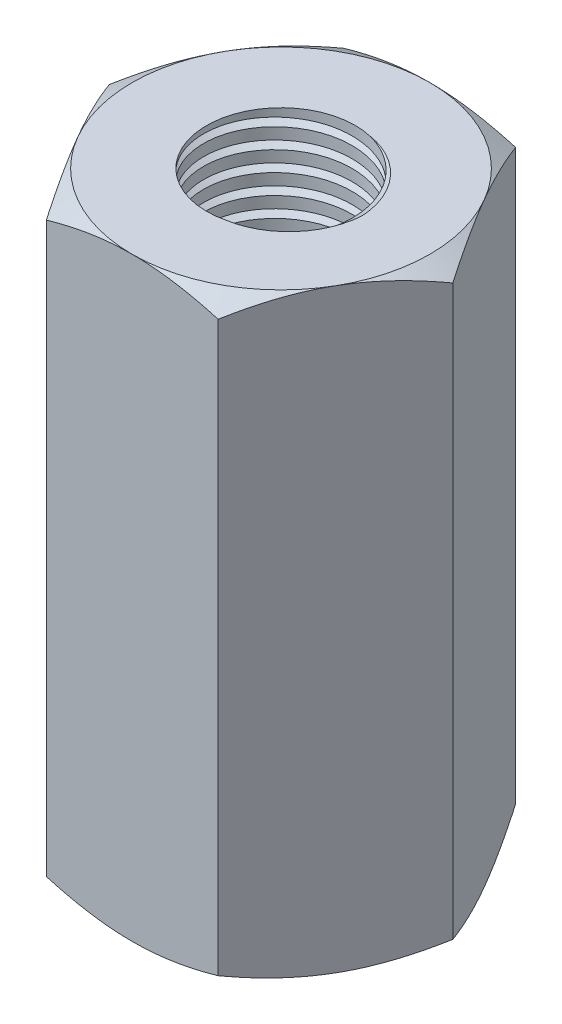
from build123d import *

# Parameters (mm, degrees)
SKETCH1_R           = 1.5
BOSS_EXTRUDE1_DEPTH = 12
SKETCH2_OUTSIDE_W   = 15.412
SKETCH2_OUTSIDE_H   = 14.484
SKETCH2_OUTSIDE_R   = 3
CUT_EXTRUDE2_DEPTH  = 1
CUT_EXTRUDE2_DRAFT  = -60
SKETCH4_OUTSIDE_W   = 15.412
SKETCH4_OUTSIDE_H   = 14.484
SKETCH4_OUTSIDE_R   = 3
CUT_EXTRUDE3_DEPTH  = 1
CUT_EXTRUDE3_DRAFT  = -60
CUT_SWEEP1_PITCH    = 0.4


with BuildPart() as part:
    # Sketch1 → Boss-Extrude1 (new body)
    with BuildSketch(Plane(origin=(0, 0, 0), x_dir=(1, 0, 0), z_dir=(0, 1, 0))):
        Polygon((3.464101615, 0), (1.732050808, 3), (-1.732050808, 3), (-3.464101615, 0), (-1.732050808, -3), (1.732050808, -3), align=None)
        with Locations(Location((0, 0, 0), (0, 0, 270))):
            Circle(SKETCH1_R, mode=Mode.SUBTRACT)
    extrude(amount=BOSS_EXTRUDE1_DEPTH)


with BuildPart() as cut_extrude2_tool:
    # Sketch2 outside → Cut-Extrude2 (with draft: the straight prism first)
    with BuildSketch(Plane(origin=(0, 12, 0), x_dir=(1, 0, 0), z_dir=(0, 1, 0))):
        Rectangle(SKETCH2_OUTSIDE_W, SKETCH2_OUTSIDE_H)
        Circle(SKETCH2_OUTSIDE_R, mode=Mode.SUBTRACT)
    extrude(amount=-CUT_EXTRUDE2_DEPTH)
    # Cut-Extrude2: the draft: its side faces are tilted about the plane it starts from
    cut_extrude2_sides = [cut_extrude2_tool.faces().sort_by_distance(p)[0] for p in [
        (0, 11.5, 7.242),
        (7.706, 11.5, 0),
        (0, 11.5, -7.242),
        (-7.706, 11.5, 0),
        (-3, 11.5, 0),
    ]]
    draft(cut_extrude2_sides, Plane(origin=(0, 12, 0), x_dir=(1, 0, 0), z_dir=(0, 1, 0)), CUT_EXTRUDE2_DRAFT)


with BuildPart() as part_1:
    add(part.part)

    # Cut-Extrude2: cut by cut_extrude2_tool
    add(cut_extrude2_tool.part, mode=Mode.SUBTRACT)


with BuildPart() as cut_extrude3_tool:
    # Sketch4 outside → Cut-Extrude3 (with draft: the straight prism first)
    with BuildSketch(Plane.XZ):
        Rectangle(SKETCH4_OUTSIDE_W, SKETCH4_OUTSIDE_H)
        Circle(SKETCH4_OUTSIDE_R, mode=Mode.SUBTRACT)
    extrude(amount=-CUT_EXTRUDE3_DEPTH)
    # Cut-Extrude3: the draft: its side faces are tilted about the plane it starts from
    cut_extrude3_sides = [cut_extrude3_tool.faces().sort_by_distance(p)[0] for p in [
        (0, 0.5, -7.242),
        (7.706, 0.5, 0),
        (0, 0.5, 7.242),
        (-7.706, 0.5, 0),
        (-3, 0.5, 0),
    ]]
    draft(cut_extrude3_sides, Plane.XZ, CUT_EXTRUDE3_DRAFT)


with BuildPart() as part_2:
    add(part_1.part)

    # Cut-Extrude3: cut by cut_extrude3_tool
    add(cut_extrude3_tool.part, mode=Mode.SUBTRACT)

    # Cut-Sweep1: arcs per turn and ends read off the stored shape
    # Cut-Sweep1: the profile of 3DSketch2 screwed along a right-hand helix through 34.75 turns, 6 arcs to a turn; built about Z, then put on its axis
    cut_sweep1_z = Axis((0, 0, 0), (0, 0, 1))
    cut_sweep1_corners = [(1.353889507, 0, -0.568713864), (1.353889507, 0, -0.231286136), (1.646110493, 0, -0.4)]
    with BuildLine(mode=Mode.PRIVATE) as cut_sweep1_profile:
        Line(cut_sweep1_corners[0], cut_sweep1_corners[1])
        Line(cut_sweep1_corners[1], cut_sweep1_corners[2])
        Line(cut_sweep1_corners[2], cut_sweep1_corners[0])
    cut_sweep1_cap = Face(cut_sweep1_profile.wire())
    cut_sweep1_turn_angles = [0, 30, 60, 90, 120, 150, 180, 210, 240, 270, 300, 330, 360]
    cut_sweep1_turn_weights = [1, 0.8660254037844387, 1, 0.8660254037844387, 1, 0.8660254037844387, 1, 0.8660254037844387, 1, 0.8660254037844387, 1, 0.8660254037844387, 1]
    cut_sweep1_turn_rails = [Edge.make_bspline([Vector(p[0], p[1], 0).rotate(cut_sweep1_z, cut_sweep1_turn_angles[k]) / cut_sweep1_turn_weights[k] + Vector(0, 0, p[2] + CUT_SWEEP1_PITCH * cut_sweep1_turn_angles[k] / 360) for k in range(13)], [0, 0, 0, 1, 1, 2, 2, 3, 3, 4, 4, 5, 5, 6, 6, 6], 2, cut_sweep1_turn_weights) for p in cut_sweep1_corners]
    cut_sweep1_turn_sides = [Face.make_surface_from_curves(cut_sweep1_turn_rails[p[0]], cut_sweep1_turn_rails[p[1]]) for p in [(0, 1), (1, 2), (2, 0)]]
    cut_sweep1_last_angles = [12240, 12270, 12300, 12330, 12360, 12390, 12420, 12450, 12480, 12495, 12510]
    cut_sweep1_last_weights = [1, 0.8660254037844387, 1, 0.8660254037844387, 1, 0.8660254037844387, 1, 0.8660254037844387, 1, 0.9659258262890683, 1]
    cut_sweep1_last_rails = [Edge.make_bspline([Vector(p[0], p[1], 0).rotate(cut_sweep1_z, cut_sweep1_last_angles[k]) / cut_sweep1_last_weights[k] + Vector(0, 0, p[2] + CUT_SWEEP1_PITCH * cut_sweep1_last_angles[k] / 360) for k in range(11)], [0, 0, 0, 1, 1, 2, 2, 3, 3, 4, 4, 5, 5, 5], 2, cut_sweep1_last_weights) for p in cut_sweep1_corners]
    cut_sweep1_last_sides = [Face.make_surface_from_curves(cut_sweep1_last_rails[p[0]], cut_sweep1_last_rails[p[1]]) for p in [(0, 1), (1, 2), (2, 0)]]
    cut_sweep1 = Plane(origin=(0, 0, 0), x_dir=(1, 0, 0), z_dir=(0, 1, 0)) * Solid(Shell([*[p.moved(Location((0, 0, CUT_SWEEP1_PITCH * i))) for i in range(34) for p in cut_sweep1_turn_sides], *cut_sweep1_last_sides, cut_sweep1_cap, cut_sweep1_cap.rotate(cut_sweep1_z, 12510).moved(Location((0, 0, CUT_SWEEP1_PITCH * 12510 / 360)))]))
    add(cut_sweep1, mode=Mode.SUBTRACT)


solid = part_2.part
